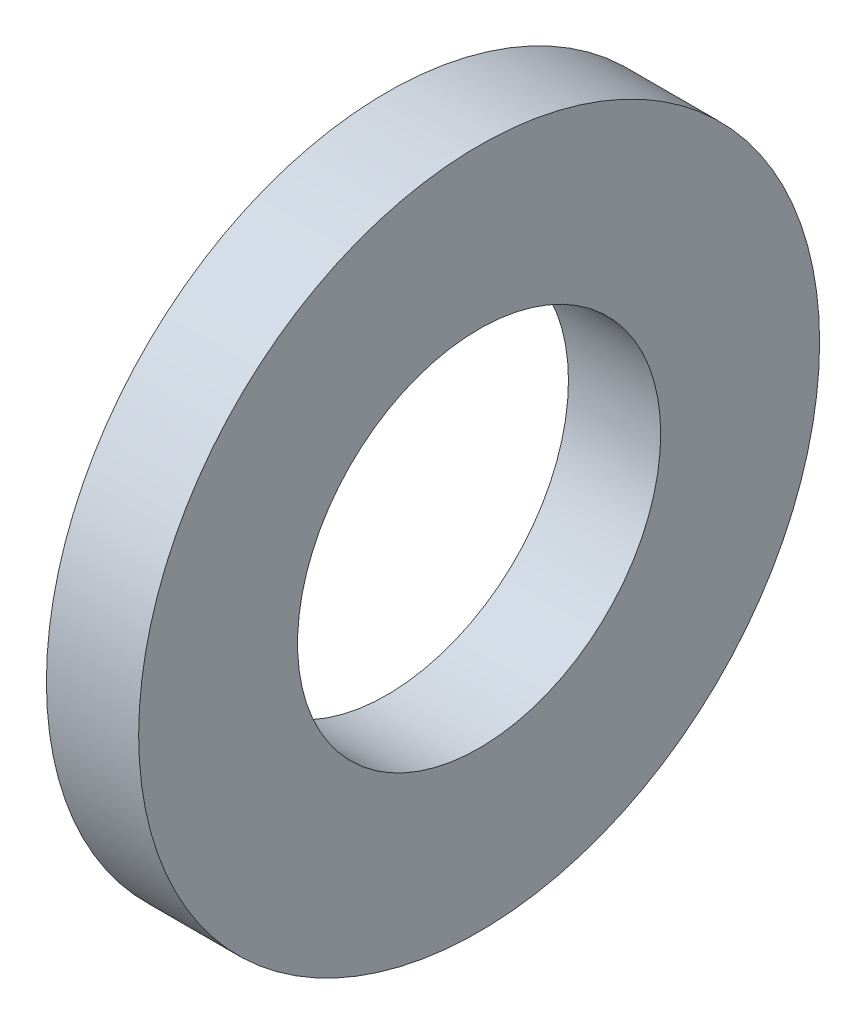
from build123d import *

# Parameters (mm, degrees)
SKETCH1_R           = 3
SKETCH1_R_2         = 1.6
BOSS_EXTRUDE1_DEPTH = 0.8128


with BuildPart() as part:
    # Sketch1 → Boss-Extrude1 (new body)
    with BuildSketch(Plane.YZ):
        Circle(SKETCH1_R)
        Circle(SKETCH1_R_2, mode=Mode.SUBTRACT)
    extrude(amount=BOSS_EXTRUDE1_DEPTH)


solid = part.part
